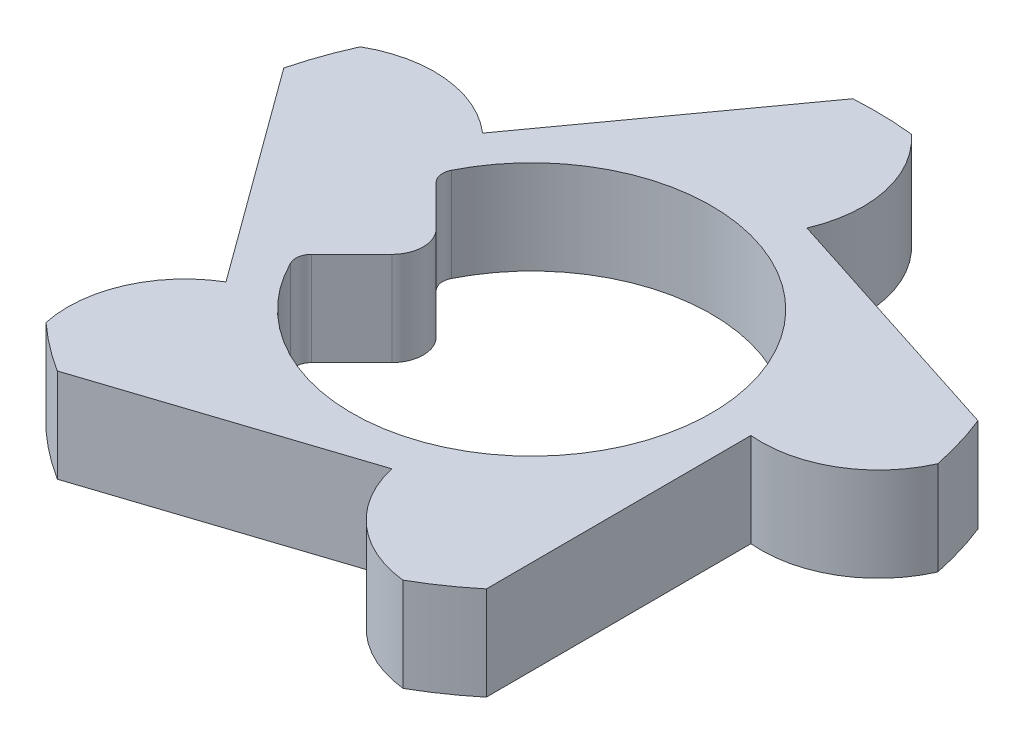
from build123d import *

# Parameters (mm, degrees)
BOSS_EXTRUDE1_DEPTH = 0.6
CUT_EXTRUDE1_REACH  = 5.137
FILLET1_R           = 0.1
FILLET2_R           = 0.2


with BuildPart() as part:
    # Sketch1 → Boss-Extrude1 (new body)
    with BuildSketch(Plane(origin=(0, 0, 0), x_dir=(1, 0, 0), z_dir=(0, 1, 0))):
        with BuildLine():
            Line((-1.130713076, -0.825522828), (-2.131397859, 0.545108401))
            ThreePointArc((-2.131397859, 0.545108401), (-2.07578756, 0.7287702), (-2.004384052, 0.906887298))
            ThreePointArc((-2.004384052, 0.906887298), (-1.555532522, 1.003410855), (-1.134528421, 0.820271456))
            Line((-1.134528421, 0.820271456), (-0.140209263, 2.195527582))
            ThreePointArc((-0.140209263, 2.195527582), (0.051648015, 2.199393662), (0.243112339, 2.186526101))
            ThreePointArc((0.243112339, 2.186526101), (0.473614448, 1.789470348), (0.42953595, 1.332478468))
            Line((0.42953595, 1.332478468), (2.044743768, 0.811802268))
            ThreePointArc((2.044743768, 0.811802268), (2.107707789, 0.630529838), (2.154635741, 0.444460149))
            ThreePointArc((2.154635741, 0.444460149), (1.848242349, 0.102542642), (1.399996238, 0.003245527))
            Line((1.399996238, 0.003245527), (1.40393041, -1.693806188))
            ThreePointArc((1.40393041, -1.693806188), (1.250987037, -1.809704792), (1.088525782, -1.911834622))
            ThreePointArc((1.088525782, -1.911834622), (0.668662143, -1.726095511), (0.435709309, -1.330472622))
            Line((0.435709309, -1.330472622), (-1.177067057, -1.858632063))
            ThreePointArc((-1.177067057, -1.858632063), (-1.33455528, -1.748988909), (-1.48188981, -1.626038927))
            ThreePointArc((-1.48188981, -1.626038927), (-1.434986417, -1.169328335), (-1.130713076, -0.825522828))
        make_face()
    extrude(amount=BOSS_EXTRUDE1_DEPTH)

    # Sketch2 → Cut-Extrude1 (cut, up to next)
    with BuildSketch(Plane(origin=(0, 0.6, 0), x_dir=(1, 0, 0), z_dir=(0, 1, 0)), mode=Mode.PRIVATE) as cut_extrude1_sk1:
        with BuildLine():
            Line((-1.059104505, 0.448104505), (-0.611, 0))
            Line((-0.611, 0), (-1.059104505, -0.448104505))
            ThreePointArc((-1.059104505, -0.448104505), (1.15, 0), (-1.059104505, 0.448104505))
        make_face()
    cut_extrude1_tool1 = extrude(cut_extrude1_sk1.sketch, amount=-CUT_EXTRUDE1_REACH, mode=Mode.PRIVATE) & part.part
    add(cut_extrude1_tool1.solids().sort_by_distance((0.062233, 0.6, 0))[0], mode=Mode.SUBTRACT)

    # Fillet1
    fillet1_edges = [part.edges().sort_by_distance(p)[0] for p in [
        (-1.059104505, 0.3, 0.448104505),
        (-1.059104505, 0.3, -0.448104505),
    ]]
    fillet(fillet1_edges, radius=FILLET1_R)

    # Fillet2
    fillet2_edges = [part.edges().sort_by_distance(p)[0] for p in [
        (-0.611, 0.3, 0),
    ]]
    fillet(fillet2_edges, radius=FILLET2_R)


solid = part.part
